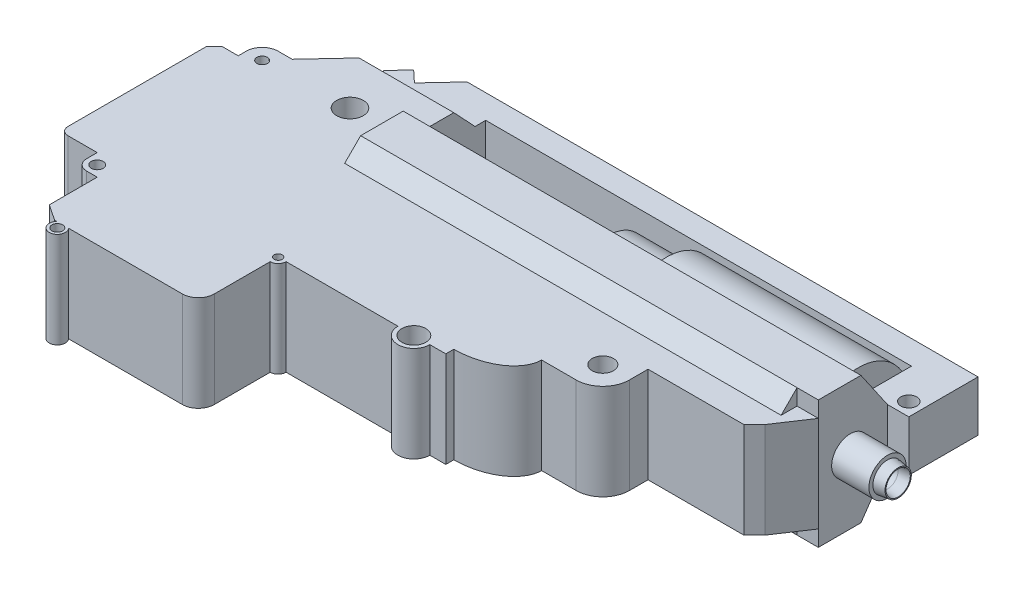
from build123d import *

# Parameters (mm, degrees)
CROQUIS1_R                 = 1.5
SALIENTE_EXTRUIR1_DEPTH    = 9.5
SALIENTE_EXTRUIR1_2_DEPTH  = 9.5
CROQUIS2_R                 = 9.5
SALIENTE_EXTRUIR2_DEPTH    = 36
CROQUIS3_R                 = 7.5
SALIENTE_EXTRUIR3_DEPTH    = 11
CROQUIS5_R                 = 3.5
SALIENTE_EXTRUIR4_DEPTH    = 33
SALIENTE_EXTRUIR5_DEPTH    = 4
CROQUIS7_R                 = 3.5
CROQUIS7_R_2               = 2
SALIENTE_EXTRUIR6_DEPTH    = 7
CROQUIS8_R                 = 2.75
CROQUIS8_R_2               = 2
SALIENTE_EXTRUIR7_DEPTH    = 2
SALIENTE_EXTRUIR7_DRAFT    = 8
SALIENTE_EXTRUIR8_DEPTH    = 23
CORTAR_EXTRUIR3_DEPTH      = 40
CORTAR_EXTRUIR3_DEPTH_BACK = 34
SALIENTE_EXTRUIR10_DEPTH   = 82
CROQUIS19_R                = 1
SALIENTE_EXTRUIR11_DEPTH   = 18
CROQUIS20_R                = 2.5
CORTAR_EXTRUIR4_DEPTH      = 18
CROQUIS21_R                = 0.999067224
CROQUIS21_R_2              = 1.124597049
CROQUIS21_R_3              = 0.75
CROQUIS21_R_4              = 2.25
CROQUIS21_R_5              = 2
SALIENTE_EXTRUIR19_DEPTH   = 18
SALIENTE_EXTRUIR20_DEPTH   = 9.5


with BuildPart() as part:
    # Croquis1 → Saliente-Extruir1 (new body)
    with BuildSketch(Plane(origin=(0, 0, 0), x_dir=(1, 0, 0), z_dir=(0, 1, 0))):
        Polygon((96, 0), (0, 0), (-4.270726999, -4.575778927), (-7.194948072, -1.846505926), (-9.924221073, -4.770726999), (-7, -7.5), (8, -7.5), (8, -4.5), (88, -4.5), (88, -13), (96, -13), (96, -10.5), align=None)
        with Locations((93.5, -10.5)):
            Circle(CROQUIS1_R, mode=Mode.SUBTRACT)
    extrude(amount=SALIENTE_EXTRUIR1_DEPTH)

    # Croquis2 → Saliente-Extruir2 (add)
    with BuildSketch(Plane.ZY.offset(-88)):
        with Locations((14.5, 4.75)):
            Circle(CROQUIS2_R)
    extrude(amount=SALIENTE_EXTRUIR2_DEPTH)

    # Croquis3 → Saliente-Extruir3 (add)
    with BuildSketch(Plane.ZY.offset(-52)):
        with Locations((14.5, 4.75)):
            Circle(CROQUIS3_R)
    extrude(amount=SALIENTE_EXTRUIR3_DEPTH)

    # Croquis5 → Saliente-Extruir4 (add)
    with BuildSketch(Plane.ZY.offset(-41)):
        with Locations((14.5, 4.75)):
            Circle(CROQUIS5_R)
    extrude(amount=SALIENTE_EXTRUIR4_DEPTH)

    # Croquis6 → Saliente-Extruir5 (add)
    with BuildSketch(Plane(origin=(88, 0, 0), x_dir=(0, 0, -1), z_dir=(1, 0, 0))):
        Polygon((-26, -7.25), (-26, 16.75), (-18, 16.75), (-13, 9.5), (-13, 0), (-18, -7.25), align=None)
    extrude(amount=SALIENTE_EXTRUIR5_DEPTH)

    # Croquis7 → Saliente-Extruir6 (add)
    with BuildSketch(Plane(origin=(92, 0, 0), x_dir=(0, 0, -1), z_dir=(1, 0, 0))):
        with Locations((-20, 4.75)):
            Circle(CROQUIS7_R)
        with Locations((-20, 4.75)):
            Circle(CROQUIS7_R_2, mode=Mode.SUBTRACT)
    extrude(amount=SALIENTE_EXTRUIR6_DEPTH)


with BuildPart() as body_2:
    # Croquis1 → Saliente-Extruir1 2 (new body)
    with BuildSketch(Plane(origin=(0, 0, 0), x_dir=(1, 0, 0), z_dir=(0, 1, 0))):
        Polygon((-10.411591252, -11.155276341), (-13.335812325, -8.42600334), (-16.065085326, -11.350224413), (-13.140864253, -14.079497414), align=None)
    extrude(amount=SALIENTE_EXTRUIR1_2_DEPTH)


with BuildPart() as saliente_extruir7_tool:
    # Croquis8 → Saliente-Extruir7 (with draft: the straight prism first)
    with BuildSketch(Plane(origin=(99, 0, 0), x_dir=(0, 0, -1), z_dir=(1, 0, 0))):
        with Locations((-20, 4.75)):
            Circle(CROQUIS8_R)
        with Locations((-20, 4.75)):
            Circle(CROQUIS8_R_2, mode=Mode.SUBTRACT)
    extrude(amount=SALIENTE_EXTRUIR7_DEPTH)
    # Saliente-Extruir7: the draft: its side faces are tilted about the plane it starts from
    saliente_extruir7_sides = [saliente_extruir7_tool.faces().sort_by_distance(p)[0] for p in [
        (100, 4.75, 22.75),
        (100, 4.75, 22),
    ]]
    draft(saliente_extruir7_sides, Plane(origin=(99, 0, 0), x_dir=(0, 0, -1), z_dir=(1, 0, 0)), SALIENTE_EXTRUIR7_DRAFT)


with BuildPart() as part_1:
    add(part.part)

    # Saliente-Extruir7: add saliente_extruir7_tool
    add(saliente_extruir7_tool.part)


    add(body_2.part)  # Saliente-Extruir8 merges body 2
    # Croquis9 → Saliente-Extruir8 (add)
    with BuildSketch(Plane.ZY.offset(-8)):
        Polygon((6.5, 9.5), (10.5, 13.75), (17.5, 13.75), (17.5, -4.25), (10.5, -4.25), (6.5, 0), (4.5, 0), (4.5, 9.5), align=None)
    extrude(amount=SALIENTE_EXTRUIR8_DEPTH)

    # Croquis17 → Cortar-Extruir3 (cut, two sides: drawn at the far end of the back side and taken through both)
    with BuildSketch(Plane(origin=(0, 13.75, 0), x_dir=(1, 0, 0), z_dir=(0, 1, 0)).offset(-CORTAR_EXTRUIR3_DEPTH_BACK)):
        Polygon((0, 0), (-16.8, 0), (-16.8, -18), align=None)
    extrude(amount=CORTAR_EXTRUIR3_DEPTH + CORTAR_EXTRUIR3_DEPTH_BACK, mode=Mode.SUBTRACT)

    # Croquis18 → Saliente-Extruir10 (add)
    with BuildSketch(Plane.ZY.offset(-88)):
        Polygon((18, -7.25), (26, -7.25), (29, -4.25), (26, -4.25), (18, -4.25), align=None)
        Polygon((26, 16.75), (18, 16.75), (18, 13.75), (26, 13.75), (29, 13.75), align=None)
    extrude(amount=SALIENTE_EXTRUIR10_DEPTH)

    # Croquis19 → Saliente-Extruir11 (add)
    with BuildSketch(Plane(origin=(0, 13.75, 0), x_dir=(1, 0, 0), z_dir=(0, 1, 0))):
        with BuildLine():
            Line((8, -24.5), (8, -17.5))
            Line((8, -17.5), (-15, -17.5))
            Line((-15, -17.5), (-15, -16.071428571))
            Line((-15, -16.071428571), (-15.866666667, -17))
            Line((-15.866666667, -17), (-16.866666667, -17))
            Line((-16.866666667, -17), (-18.5, -17))
            ThreePointArc((-18.5, -17), (-20.621320344, -17.878679656), (-21.5, -20))
            Line((-21.5, -20), (-21.5, -21.5))
            Line((-21.5, -21.5), (-24.5, -21.5))
            Line((-24.5, -21.5), (-26, -23))
            Line((-26, -23), (-26, -24.5))
            Line((-26, -24.5), (8, -24.5))
        make_face()
        with Locations((-18.5, -20)):
            Circle(CROQUIS19_R, mode=Mode.SUBTRACT)
    extrude(amount=-SALIENTE_EXTRUIR11_DEPTH)

    # Croquis20 → Cortar-Extruir4 (cut)
    with BuildSketch(Plane(origin=(0, 13.75, 0), x_dir=(1, 0, 0), z_dir=(0, 1, 0))):
        with Locations((-2.5, -19.5)):
            Circle(CROQUIS20_R)
    extrude(amount=-CORTAR_EXTRUIR4_DEPTH, mode=Mode.SUBTRACT)

    # Croquis21 → Saliente-Extruir19 (add)
    with BuildSketch(Plane(origin=(0, 13.75, 0), x_dir=(1, 0, 0), z_dir=(0, 1, 0))):
        with BuildLine():
            Line((6, -24.5), (-26, -24.5))
            Line((-26, -24.5), (-26, -49))
            ThreePointArc((-26, -49), (-25.560660172, -50.060660172), (-24.5, -50.5))
            Line((-24.5, -50.5), (-19, -50.5))
            Line((-19, -50.5), (-19, -52.5))
            ThreePointArc((-19, -52.5), (-18.414213562, -53.914213562), (-17, -54.5))
            Line((-17, -54.5), (-15, -54.5))
            Line((-15, -54.5), (-15, -63.5))
            Line((-15, -63.5), (-12, -65.5))
            Line((-12, -65.5), (-11.618033989, -65.5))
            ThreePointArc((-11.618033989, -65.5), (-10.5, -68), (-9.381966011, -65.5))
            Line((-9.381966011, -65.5), (12, -65.5))
            ThreePointArc((12, -65.5), (14.121320344, -64.621320344), (15, -62.5))
            Line((15, -62.5), (15, -52))
            ThreePointArc((15, -52), (16.060660172, -51.560660172), (16.5, -50.5))
            Line((16.5, -50.5), (37.5, -50.5))
            ThreePointArc((37.5, -50.5), (40.5, -53.5), (43.5, -50.5))
            Line((43.5, -50.5), (46.5, -50.5))
            Line((46.5, -50.5), (46.5, -49))
            add(Edge.make_bspline(
                [(46.5, -49), (56.5, -49), (56.5, -42.5)],
                knots=[4.71238898, 4.71238898, 4.71238898, 6.283185307, 6.283185307, 6.283185307], degree=2, weights=[1, 0.707106781, 1]))
            Line((56.5, -42.5), (63, -42.5))
            ThreePointArc((63, -42.5), (66.535533906, -41.035533906), (68, -37.5))
            Line((68, -37.5), (68, -34))
            Line((68, -34), (86, -34))
            Line((86, -34), (88, -32))
            Line((88, -32), (92, -26))
            Line((92, -26), (92, -24.5))
            Line((92, -24.5), (6, -24.5))
        make_face()
        with Locations((-10.5, -66.5)):
            Circle(CROQUIS21_R, mode=Mode.SUBTRACT)
        with Locations((-17, -52.5)):
            Circle(CROQUIS21_R_2, mode=Mode.SUBTRACT)
        with Locations((15, -50.5)):
            Circle(CROQUIS21_R_3, mode=Mode.SUBTRACT)
        with Locations((40.5, -50.5)):
            Circle(CROQUIS21_R_4, mode=Mode.SUBTRACT)
        with Locations((63, -37.5)):
            Circle(CROQUIS21_R_5, mode=Mode.SUBTRACT)
    extrude(amount=-SALIENTE_EXTRUIR19_DEPTH)

    # Croquis22 → Saliente-Extruir20 (add)
    with BuildSketch(Plane(origin=(0, 9.5, 0), x_dir=(1, 0, 0), z_dir=(0, 1, 0))):
        Polygon((-4.776227753, -5.117386878), (-6.969393557, -3.070432127), (-9.698666559, -5.9946532), (-7.505500754, -8.041607951), align=None)
        Polygon((-10.234773755, -10.965829024), (-12.42793956, -8.918874273), (-15.157212562, -11.843095346), (-12.964046757, -13.890050097), align=None)
    extrude(amount=-SALIENTE_EXTRUIR20_DEPTH)


solid = part_1.part
